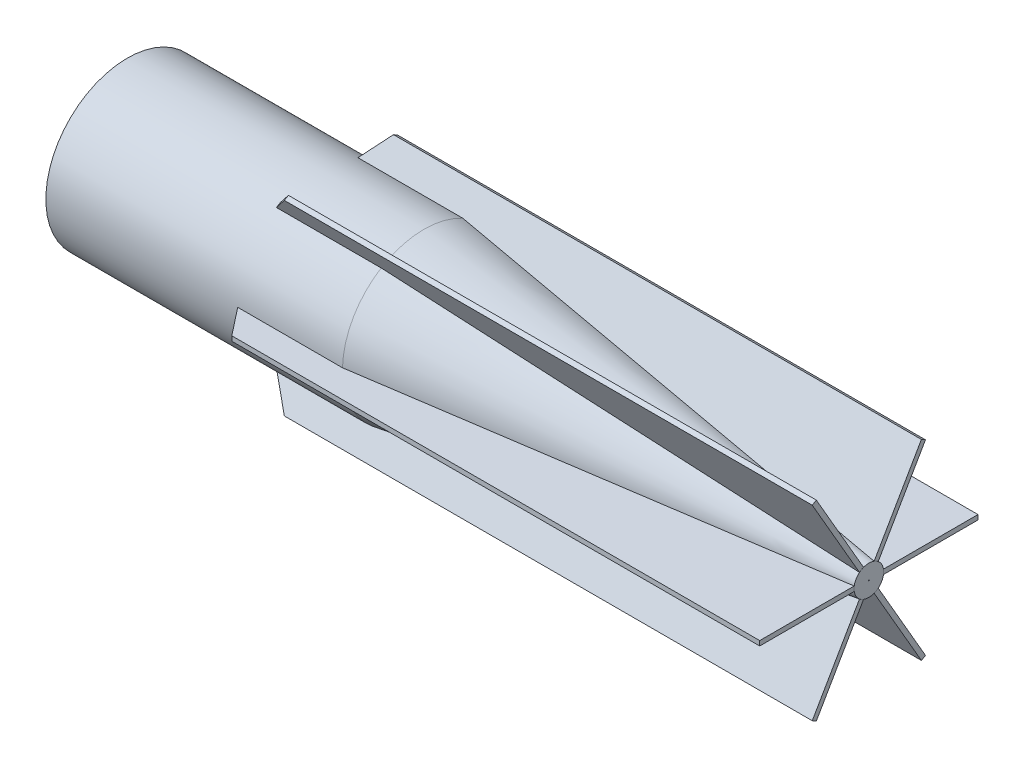
from build123d import *

# Parameters (mm, degrees)
BOSS_EXTRUDE2_DEPTH = 0.79375
CIRPATTERN2_COUNT   = 6


with BuildPart() as part:
    # Sketch1 → Revolve1 (revolve)
    with BuildSketch(Plane(origin=(0, 0, 0), x_dir=(1, 0, 0), z_dir=(0, 1, 0))):
        Polygon((-250, 0), (-150, 0), (-1, -22.35), (0, -22.35), (0, -17.5), (-150, 5), (-250, 5), align=None)
    revolve(axis=Axis((0, 0, 22.5), (-1, 0, 0)))

    # Sketch3 → Boss-Extrude2 (add, symmetric)
    with BuildSketch(Plane(origin=(0, 0, 0), x_dir=(1, 0, 0), z_dir=(0, 1, 0))):
        Polygon((-186.883647799, 3), (-150.149165611, 3), (-13.482498944, -17.5), (0, -17.5), (0, 14.3), (-178, 14.3), align=None)
    boss_extrude2 = extrude(amount=BOSS_EXTRUDE2_DEPTH, both=True)

    # CirPattern2: Boss-Extrude2 ×6 about axis
    cirpattern2_axis = Axis((0, 0, 22.5), (-1, 0, 0))
    for i in range(1, CIRPATTERN2_COUNT):
        add(boss_extrude2.rotate(cirpattern2_axis, i * 360 / CIRPATTERN2_COUNT))


solid = part.part
